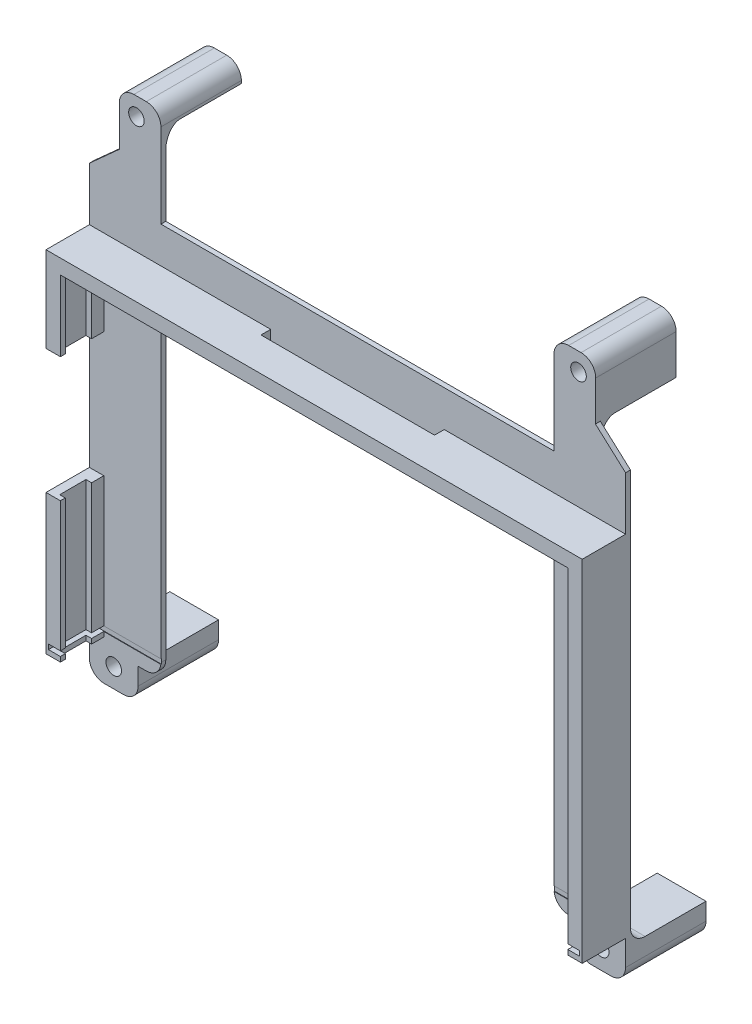
from build123d import *

# Parameters (mm, degrees)
SKETCH1_W             = 6.535180092
SKETCH1_H             = 10
SKETCH1_R             = 1.6
BOSS_EXTRUDE1_DEPTH   = 15.5
BOSS_EXTRUDE1_2_DEPTH = 15.5
BOSS_EXTRUDE1_3_DEPTH = 15.5
BOSS_EXTRUDE1_4_DEPTH = 15.5
SKETCH2_R             = 1.6
BOSS_EXTRUDE2_DEPTH   = 1
SKETCH3_W             = 2.95
SKETCH3_H             = 28.672472045
BOSS_EXTRUDE3_DEPTH   = 2.5
BOSS_EXTRUDE4_DEPTH   = 5.4
SKETCH5_W             = 2.95
SKETCH5_H             = 28.672472045
BOSS_EXTRUDE5_DEPTH   = 1
SKETCH7_W             = 109
SKETCH7_H             = 1
CUT_EXTRUDE1_DEPTH    = 9
FILLET1_R             = 3
FILLET2_R             = 3
SKETCH8_W             = 35.6
SKETCH8_H             = 2
CUT_EXTRUDE2_DEPTH    = 2


with BuildPart() as part:
    # Sketch1 → Boss-Extrude1 (new body)
    with BuildSketch(Plane(origin=(0, 0, 0), x_dir=(0, 1, 0), z_dir=(0, 0, 1))):
        with Locations((-50.739127193, -49.754164457)):
            Rectangle(SKETCH1_W, SKETCH1_H)
        with Locations(Location((-50.006717239, -49.754164457, 0), (0, 0, 270))):
            Circle(SKETCH1_R, mode=Mode.SUBTRACT)
    extrude(amount=BOSS_EXTRUDE1_DEPTH)



with BuildPart() as body_2:
    # Sketch1 → Boss-Extrude1 2 (new body)
    with BuildSketch(Plane(origin=(0, 0, 0), x_dir=(0, 1, 0), z_dir=(0, 0, 1))):
        Polygon((42.477965747, -48.576148962), (50.136732851, -40.077363358), (53.691226628, -40.077363358), (53.691226628, -48.640781304), align=None)
        with Locations(Location((49.993282761, -45.101777457, 0), (0, 0, 270))):
            Circle(SKETCH1_R, mode=Mode.SUBTRACT)
    extrude(amount=BOSS_EXTRUDE1_2_DEPTH)


with BuildPart() as body_3:
    # Sketch1 → Boss-Extrude1 3 (new body)
    with BuildSketch(Plane(origin=(0, 0, 0), x_dir=(0, 1, 0), z_dir=(0, 0, 1))):
        Polygon((53.691226628, 49.132452389), (42.477965747, 49.067820047), (50.136732851, 40.569034443), (53.691226628, 40.569034443), align=None)
        with Locations(Location((49.993282761, 45.593448542, 0), (0, 0, 90))):
            Circle(SKETCH1_R, mode=Mode.SUBTRACT)
    extrude(amount=BOSS_EXTRUDE1_3_DEPTH)


with BuildPart() as body_4:
    # Sketch1 → Boss-Extrude1 4 (new body)
    with BuildSketch(Plane(origin=(0, 0, 0), x_dir=(0, 1, 0), z_dir=(0, 0, 1))):
        with Locations((-50.739127193, 50.245835543)):
            Rectangle(SKETCH1_W, SKETCH1_H)
        with Locations(Location((-50.006717239, 50.245835543, 0), (0, 0, 90))):
            Circle(SKETCH1_R, mode=Mode.SUBTRACT)
    extrude(amount=BOSS_EXTRUDE1_4_DEPTH)


with BuildPart() as part_1:
    add(part.part)

    add(body_2.part)  # Boss-Extrude2 merges body 2

    add(body_3.part)  # Boss-Extrude2 merges body 3

    add(body_4.part)  # Boss-Extrude2 merges body 4
    # Sketch2 → Boss-Extrude2 (add)
    with BuildSketch(Plane.XY.offset(15.5)):
        Polygon((54.754164457, -47.471537147), (54.754164457, -54.006717239), (44.754164457, -54.006717239), (44.754164457, -47.471537147), (40.077363358, -47.471537147), (40.077363358, 20.986771333), (-40.569034443, 20.986771333), (-40.569034443, -47.471537147), (-45.245835543, -47.471537147), (-45.245835543, -54.006717239), (-55.245835543, -54.006717239), (-55.245835543, -47.471537147), (-55.245835543, 36.910584236), (-49.067820047, 42.477965747), (-49.132452389, 53.691226628), (-40.569034443, 53.691226628), (-40.569034443, 33.42328432), (40.077363358, 33.42328432), (40.077363358, 53.691226628), (48.640781304, 53.691226628), (48.576148962, 42.477965747), (54.754164457, 36.910584236), align=None)
        with Locations((49.754164457, -50.006717239)):
            Circle(SKETCH2_R, mode=Mode.SUBTRACT)
        with Locations((45.101777457, 49.993282761)):
            Circle(SKETCH2_R, mode=Mode.SUBTRACT)
        with Locations(Location((-45.593448542, 49.993282761, 0), (0, 0, 180))):
            Circle(SKETCH2_R, mode=Mode.SUBTRACT)
        with Locations(Location((-50.245835543, -50.006717239, 0), (0, 0, 180))):
            Circle(SKETCH2_R, mode=Mode.SUBTRACT)
    extrude(amount=BOSS_EXTRUDE2_DEPTH)

    # Sketch3 → Boss-Extrude3 (add)
    with BuildSketch(Plane.XY.offset(16.5)):
        Polygon((-52.295835543, 8.439904174), (-52.295835543, 22.986771333), (51.804164457, 22.986771333), (51.804164457, -45.813228667), (54.754164457, -45.813228667), (54.754164457, 25.986771333), (-55.245835543, 25.986771333), (-55.245835543, 8.439904174), align=None)
        with Locations((-53.770835543, -31.476992645)):
            Rectangle(SKETCH3_W, SKETCH3_H)
    extrude(amount=BOSS_EXTRUDE3_DEPTH)

    # Sketch4 → Boss-Extrude4 (add)
    with BuildSketch(Plane.XY.offset(19)):
        Polygon((-55.245835543, 25.986771333), (54.754164457, 25.986771333), (54.754164457, -45.813228667), (52.954164457, -45.813228667), (52.954164457, -43.913228667), (52.954164457, 24.086771333), (-53.445835543, 24.086771333), (-53.445835543, 8.439904174), (-55.245835543, 8.439904174), align=None)
        Polygon((-55.245835543, -45.813228667), (-53.445835543, -45.813228667), (-53.445835543, -43.913228667), (-53.445835543, -17.140756622), (-55.245835543, -17.140756622), align=None)
    extrude(amount=BOSS_EXTRUDE4_DEPTH)

    # Sketch5 → Boss-Extrude5 (add)
    with BuildSketch(Plane.XY.offset(24.4)):
        Polygon((-55.245835543, 8.439904174), (-52.295835543, 8.439904174), (-52.295835543, 22.986771333), (51.804164457, 22.986771333), (51.804164457, -45.813228667), (54.754164457, -45.813228667), (54.754164457, 25.986771333), (-55.245835543, 25.986771333), align=None)
        with Locations((-53.770835543, -31.476992645)):
            Rectangle(SKETCH5_W, SKETCH5_H)
    extrude(amount=BOSS_EXTRUDE5_DEPTH)

    # Sketch7 → Cut-Extrude1 (cut)
    with BuildSketch(Plane.XY.offset(25.4)):
        with Locations((-0.245835543, -44.313228667)):
            Rectangle(SKETCH7_W, SKETCH7_H)
    extrude(amount=-CUT_EXTRUDE1_DEPTH, mode=Mode.SUBTRACT)

    # Fillet1
    fillet1_edges = [part_1.edges().sort_by_distance(p)[0] for p in [
        (48.640781304, 53.691226628, 7.75),
        (-49.132452389, 53.691226628, 7.75),
        (-40.569034443, -47.471537147, 16),
        (-55.245835543, -54.006717239, 8.25),
        (-45.245835543, -54.006717239, 8.25),
        (40.077363358, -47.471537147, 16),
        (44.754164457, -54.006717239, 8.25),
        (54.754164457, -54.006717239, 8.25),
        (40.077363358, 53.691226628, 7.75),
        (-40.569034443, 53.691226628, 7.75),
    ]]
    fillet(fillet1_edges, radius=FILLET1_R)

    # Fillet2
    # the kernel refuses this fillet: 3 mm, written as the material it adds along each edge
    with BuildSketch(Plane(origin=(54.147639825, 37.457160078, 15.5), x_dir=(0, 0, -1), z_dir=(-0.7428654483971854, 0.6694407558385198, 0))) as fillet2_piece_1_section:
        with BuildLine():
            CenterArc((FILLET2_R, FILLET2_R), FILLET2_R, 180, 90)
            Line((0, FILLET2_R), (0, 0))
            Line((0, 0), (FILLET2_R, 0))
        make_face()
    fillet2_piece_1 = extrude(amount=26.440545017, mode=Mode.PRIVATE)
    fillet2_piece_1 = split(fillet2_piece_1, bisect_by=Plane(origin=(48.592895704, 45.383408694, 14.829727011), z_dir=(-0.9999833890252455, 0.005763824562264406, 0)), keep=Keep.TOP, mode=Mode.PRIVATE)
    fillet2_piece_1 = split(fillet2_piece_1, bisect_by=Plane(origin=(40.077363358, 45.408013282, 14.829727011), z_dir=(1, 0, 0)), keep=Keep.TOP, mode=Mode.PRIVATE)
    add(fillet2_piece_1)
    with BuildSketch(Plane(origin=(-54.63931091, 37.457160078, 15.5), x_dir=(0, 0, -1), z_dir=(0.7428654483971854, 0.6694407558385198, 0))) as fillet2_piece_2_section:
        with BuildLine():
            CenterArc((FILLET2_R, -FILLET2_R), FILLET2_R, 90, 90)
            Line((0, -FILLET2_R), (0, 0))
            Line((0, 0), (FILLET2_R, 0))
        make_face()
    fillet2_piece_2 = extrude(amount=26.440545017, mode=Mode.PRIVATE)
    fillet2_piece_2 = split(fillet2_piece_2, bisect_by=Plane(origin=(-40.569034443, 45.408013282, 14.829727011), z_dir=(-1, 0, 0)), keep=Keep.TOP, mode=Mode.PRIVATE)
    fillet2_piece_2 = split(fillet2_piece_2, bisect_by=Plane(origin=(-49.084566789, 45.383408694, 14.829727011), z_dir=(0.9999833890252455, 0.005763824562264406, 0)), keep=Keep.TOP, mode=Mode.PRIVATE)
    add(fillet2_piece_2)
    with BuildSketch(Plane(origin=(-45.245835543, -47.471537147, 15.5), x_dir=(0, 0, -1), z_dir=(-1, 0, 0)), Plane(origin=(44.754164457, -47.471537147, 15.5), x_dir=(0, 1, 0), z_dir=(1, 0, 0))) as fillet2_piece_3:
        with BuildLine():
            CenterArc((FILLET2_R, -FILLET2_R), FILLET2_R, 90, 90)
            Line((0, -FILLET2_R), (0, 0))
            Line((0, 0), (FILLET2_R, 0))
        make_face()
    extrude(amount=10)

    # Sketch8 → Cut-Extrude2 (cut)
    with BuildSketch(Plane(origin=(0, 25.986771333, 0), x_dir=(-1, 0, 0), z_dir=(0, 1, 0))):
        with Locations((0.245835543, 17.5)):
            Rectangle(SKETCH8_W, SKETCH8_H)
    extrude(amount=-CUT_EXTRUDE2_DEPTH, mode=Mode.SUBTRACT)


solid = part_1.part
